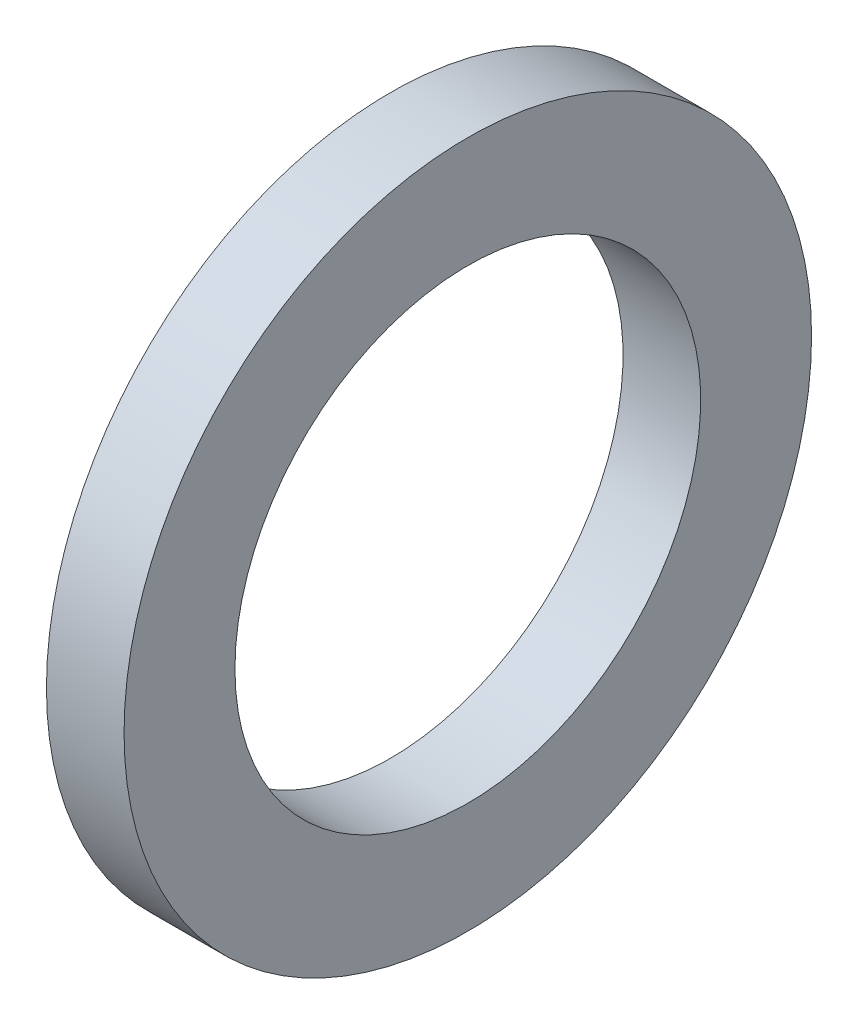
from build123d import *

# Parameters (mm, degrees)
SKETCH1_W = 3.5
SKETCH1_H = 5


with BuildPart() as part:
    # Sketch1 → Base-Revolve (revolve)
    with BuildSketch(Plane.XY):
        with Locations((-1.75, 13)):
            Rectangle(SKETCH1_W, SKETCH1_H)
    revolve(axis=Axis((-34.925, 0, 0), (1, 0, 0)))


solid = part.part
